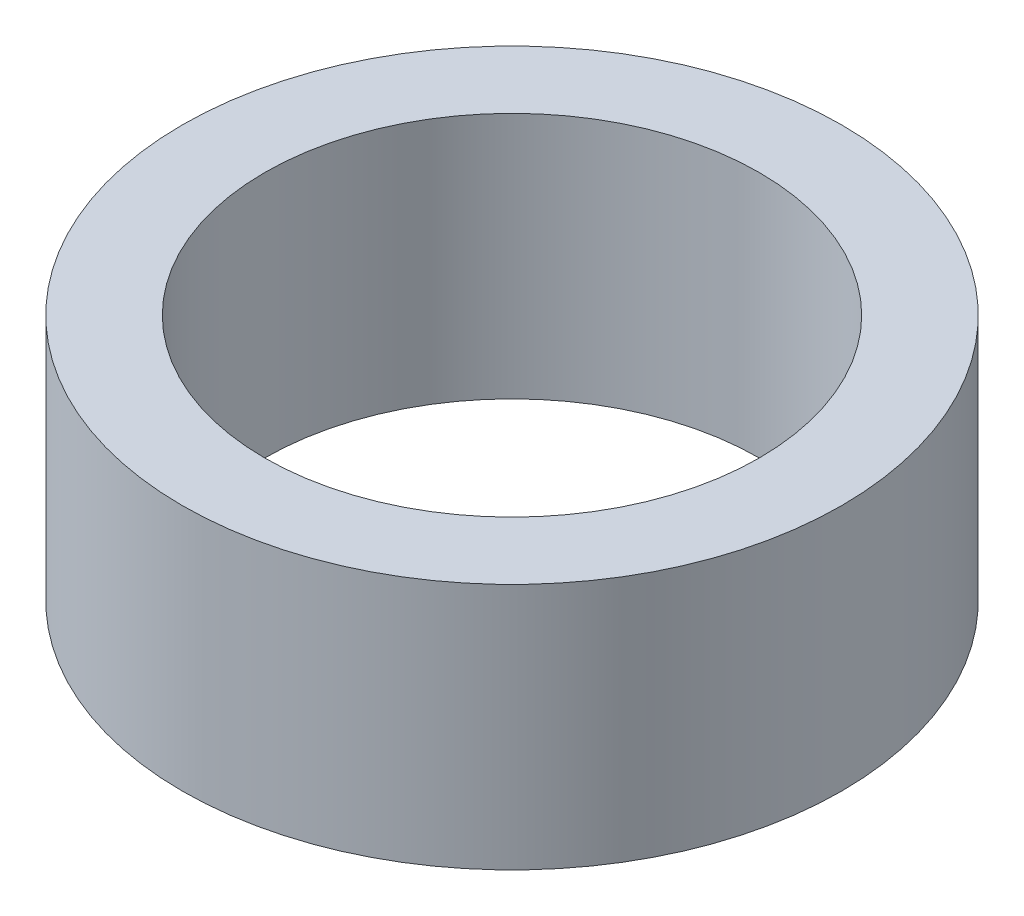
from build123d import *

# Parameters (mm, degrees)
SKETCH1_R           = 6.35
SKETCH1_R_2         = 4.7625
BOSS_EXTRUDE1_DEPTH = 4.7625


with BuildPart() as part:
    # Sketch1 → Boss-Extrude1 (new body)
    with BuildSketch(Plane(origin=(0, 0, 0), x_dir=(1, 0, 0), z_dir=(0, 1, 0))):
        Circle(SKETCH1_R)
        Circle(SKETCH1_R_2, mode=Mode.SUBTRACT)
    extrude(amount=BOSS_EXTRUDE1_DEPTH)


solid = part.part
